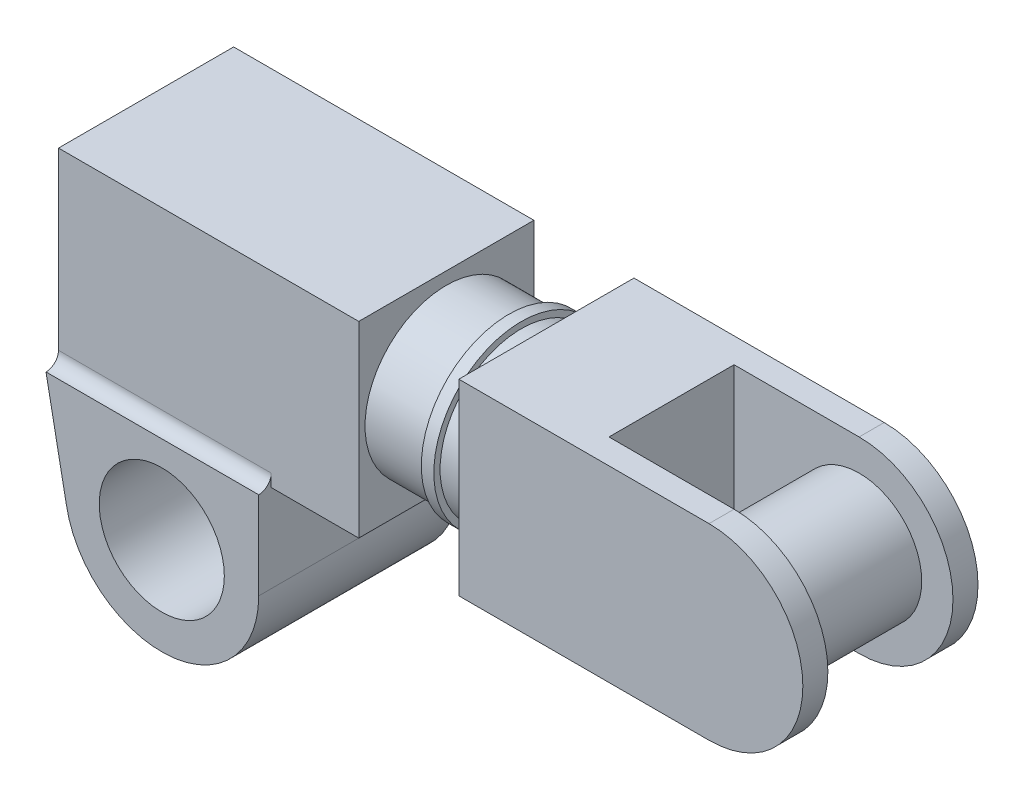
from build123d import *

# Parameters (mm, degrees)
SKETCH2_W           = 140
SKETCH2_H           = 150
BOSS_EXTRUDE1_DEPTH = 240
SKETCH3_R           = 65
BOSS_EXTRUDE2_DEPTH = 50
SKETCH4_R           = 70
BOSS_EXTRUDE3_DEPTH = 10
SKETCH5_R           = 50
BOSS_EXTRUDE4_DEPTH = 80
FILLET1_R           = 10
SKETCH6_R           = 65
BOSS_EXTRUDE5_DEPTH = 20
BOSS_EXTRUDE6_DEPTH = 70
CUT_EXTRUDE1_DEPTH  = 50
BOSS_EXTRUDE7_REACH = 650.407
SKETCH9_R           = 50


with BuildPart() as part:
    # Sketch2 → Boss-Extrude1 (new body)
    with BuildSketch(Plane(origin=(0, 0, 0), x_dir=(0, 0, -1), z_dir=(1, 0, 0))):
        Rectangle(SKETCH2_W, SKETCH2_H)
    extrude(amount=BOSS_EXTRUDE1_DEPTH)

    # Sketch3 → Boss-Extrude2 (add)
    with BuildSketch(Plane(origin=(240, 0, 0), x_dir=(0, 0, -1), z_dir=(1, 0, 0))):
        Circle(SKETCH3_R)
    extrude(amount=BOSS_EXTRUDE2_DEPTH)

    # Sketch4 → Boss-Extrude3 (add)
    with BuildSketch(Plane(origin=(290, 0, 0), x_dir=(0, 0, -1), z_dir=(1, 0, 0))):
        Circle(SKETCH4_R)
    extrude(amount=BOSS_EXTRUDE3_DEPTH)

    # Sketch5 → Boss-Extrude4 (add, symmetric)
    with BuildSketch(Plane.XY):
        with BuildLine():
            Line((170.044787747, -145), (170.044787747, -75))
            Line((170.044787747, -75), (0, -75))
            Line((0, -75), (16.218764607, -158.438310593))
            ThreePointArc((16.218764607, -158.438310593), (99.289534096, -222.205947936), (170.044787747, -145))
        make_face()
        with Locations((92.544787747, -145)):
            Circle(SKETCH5_R, mode=Mode.SUBTRACT)
    extrude(amount=BOSS_EXTRUDE4_DEPTH, both=True)

    # Fillet1
    fillet1_edges = [part.edges().sort_by_distance(p)[0] for p in [
        (85.022393874, -75, -70),
        (85.022393874, -75, 70),
    ]]
    fillet(fillet1_edges, radius=FILLET1_R - 0.0001)  # a hair under: the kernel refuses the full size

    # Sketch6 → Boss-Extrude5 (add)
    with BuildSketch(Plane(origin=(300, 0, 0), x_dir=(0, 0, -1), z_dir=(1, 0, 0))):
        Circle(SKETCH6_R)
    extrude(amount=BOSS_EXTRUDE5_DEPTH)

    # Sketch7 → Boss-Extrude6 (add, symmetric)
    with BuildSketch(Plane.XY):
        with BuildLine():
            Line((520, -75), (320, -75))
            Line((320, -75), (320, 75))
            Line((320, 75), (520, 75))
            ThreePointArc((520, 75), (595, 0), (520, -75))
        make_face()
    extrude(amount=BOSS_EXTRUDE6_DEPTH, both=True)

    # Sketch8 → Cut-Extrude1 (cut, symmetric)
    with BuildSketch(Plane.XY):
        with BuildLine():
            Line((520, 75), (420, 75))
            Line((420, 75), (420, -75))
            Line((420, -75), (520, -75))
            ThreePointArc((520, -75), (595, 0), (520, 75))
        make_face()
    extrude(amount=CUT_EXTRUDE1_DEPTH, both=True, mode=Mode.SUBTRACT)

    # Sketch9 → Boss-Extrude7 (add, up to next)
    with BuildSketch(Plane.XY.offset(-50), mode=Mode.PRIVATE) as boss_extrude7_sk1:
        with Locations((520, 0)):
            Circle(SKETCH9_R)
    boss_extrude7_tool1 = extrude(boss_extrude7_sk1.sketch, amount=BOSS_EXTRUDE7_REACH, mode=Mode.PRIVATE) - part.part
    add(boss_extrude7_tool1.solids().sort_by_distance((520, 0, -50))[0])


solid = part.part
